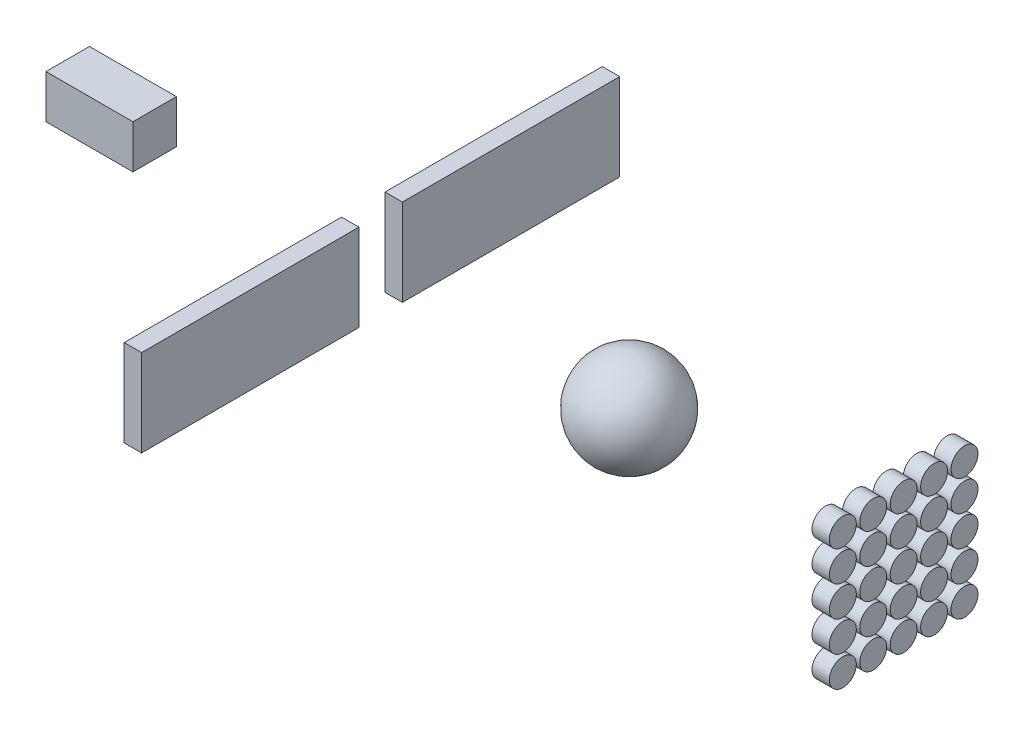
from build123d import *

# Parameters (mm, degrees)
SKETCH2_W             = 100
SKETCH2_H             = 50
BOSS_EXTRUDE2_DEPTH   = 25
SKETCH3_W             = 20
SKETCH3_H             = 15.5
SKETCH4_W             = 20
SKETCH4_H             = 250
BOSS_EXTRUDE3_DEPTH   = 50
BOSS_EXTRUDE3_2_DEPTH = 50
LPATTERN1_START       = 591.7
LPATTERN1_OUTLINE_R   = 15.5
LPATTERN1_DEPTH       = 20


# Read off the part's stored shape, not the designer's step: LPattern1
with BuildPart() as part:
    # Sketch2 → Boss-Extrude2 (new, symmetric)
    with BuildSketch(Plane.XY):
        with Locations((-300, 0)):
            Rectangle(SKETCH2_W, SKETCH2_H)
    extrude(amount=BOSS_EXTRUDE2_DEPTH, both=True)


with BuildPart() as body_2:
    # Sketch3 → Revolve1 (revolve)
    with BuildSketch(Plane(origin=(0, 0, 0), x_dir=(1, 0, 0), z_dir=(0, 1, 0))):
        with BuildLine():
            Line((240, 0), (351.7, 0))
            ThreePointArc((351.7, 0), (295.85, 55.85), (240, 0))
        make_face()
        with Locations((601.7, 7.75)):
            Rectangle(SKETCH3_W, SKETCH3_H)
    revolve(axis=Axis((0, 0, 0), (1, 0, 0)))


with BuildPart() as body_3:
    # Sketch4 → Boss-Extrude3 (new, symmetric)
    with BuildSketch(Plane(origin=(0, 0, 0), x_dir=(1, 0, 0), z_dir=(0, 1, 0))):
        with Locations((0, 150)):
            Rectangle(SKETCH4_W, SKETCH4_H)
    extrude(amount=BOSS_EXTRUDE3_DEPTH, both=True)


with BuildPart() as body_4:
    # Sketch4 → Boss-Extrude3 2 (new, symmetric)
    with BuildSketch(Plane(origin=(0, 0, 0), x_dir=(1, 0, 0), z_dir=(0, 1, 0))):
        with Locations((0, -150)):
            Rectangle(SKETCH4_W, SKETCH4_H)
    extrude(amount=BOSS_EXTRUDE3_2_DEPTH, both=True)


with BuildPart() as body_5:
    # LPattern1 outline → LPattern1 (new body)
    with BuildSketch(Plane.YZ.offset(LPATTERN1_START)):
        with Locations((70, 70)):
            Circle(LPATTERN1_OUTLINE_R)
        with Locations((70, 35)):
            Circle(LPATTERN1_OUTLINE_R)
        with Locations((70, 0)):
            Circle(LPATTERN1_OUTLINE_R)
        with Locations((35, 70)):
            Circle(LPATTERN1_OUTLINE_R)
        with Locations((35, 35)):
            Circle(LPATTERN1_OUTLINE_R)
        with Locations((35, 0)):
            Circle(LPATTERN1_OUTLINE_R)
        with Locations((0, 70)):
            Circle(LPATTERN1_OUTLINE_R)
        with Locations((0, 35)):
            Circle(LPATTERN1_OUTLINE_R)
    extrude(amount=LPATTERN1_DEPTH)

    # Mirror1: body 5 across plane


with BuildPart() as body_5_1:
    add(body_5.part)
    add(body_5.part.mirror(Plane.XY))

    # Mirror2: body 5 across plane


with BuildPart() as body_5_2:
    add(body_5_1.part)
    add(body_5_1.part.mirror(Plane.ZX))


solid = Compound([part.part, body_2.part, body_3.part, body_4.part, body_5_2.part])
